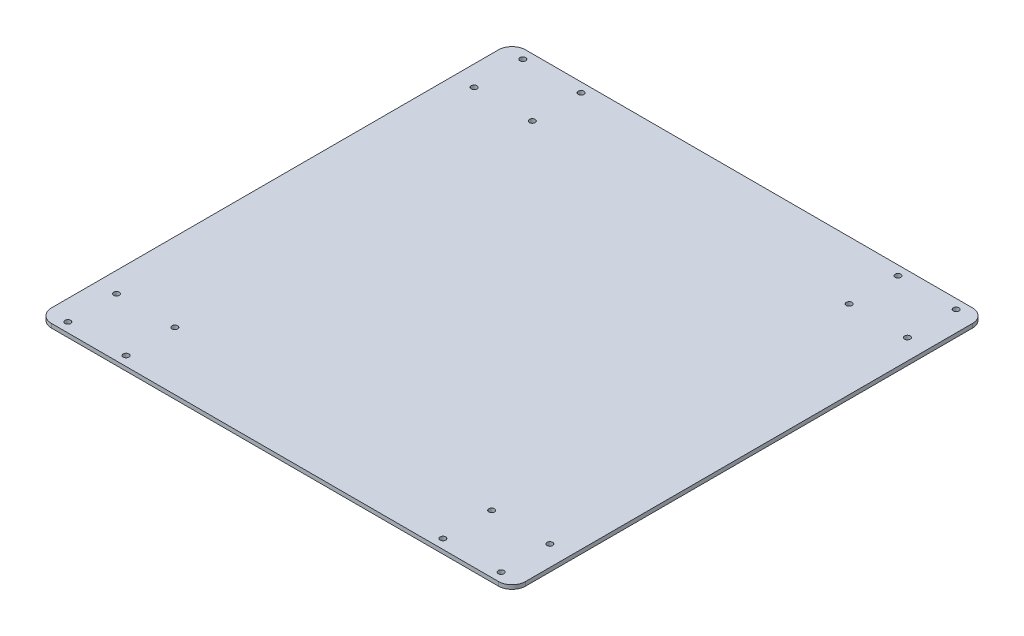
from build123d import *

# Parameters (mm, degrees)
SKETCH1_W           = 350
SKETCH1_H           = 350
BOSS_EXTRUDE1_DEPTH = 3
FILLET1_R           = 10
SKETCH2_R           = 2.1
CUT_EXTRUDE1_DEPTH  = 495.98383812


with BuildPart() as part:
    # Sketch1 → Boss-Extrude1 (new body)
    with BuildSketch(Plane(origin=(0, 0, 0), x_dir=(1, 0, 0), z_dir=(0, 1, 0))):
        with Locations((175, 175)):
            Rectangle(SKETCH1_W, SKETCH1_H)
    extrude(amount=BOSS_EXTRUDE1_DEPTH)

    # Fillet1
    fillet1_edges = [part.edges().sort_by_distance(p)[0] for p in [
        (0, 1.5, -350),
        (350, 1.5, -350),
        (350, 1.5, 0),
        (0, 1.5, 0),
    ]]
    fillet(fillet1_edges, radius=FILLET1_R)

    # Sketch2 → Cut-Extrude1 (cut, through all)
    with BuildSketch(Plane(origin=(0, 3, 0), x_dir=(1, 0, 0), z_dir=(0, 1, 0))):
        with Locations((15, 343)):
            Circle(SKETCH2_R)
        with Locations((58, 343)):
            Circle(SKETCH2_R)
        with Locations((15, 307)):
            Circle(SKETCH2_R)
        with Locations((58, 307)):
            Circle(SKETCH2_R)
        with Locations((292, 307)):
            Circle(SKETCH2_R)
        with Locations((335, 307)):
            Circle(SKETCH2_R)
        with Locations((292, 343)):
            Circle(SKETCH2_R)
        with Locations((335, 343)):
            Circle(SKETCH2_R)
        with Locations((335, 7)):
            Circle(SKETCH2_R)
        with Locations((292, 7)):
            Circle(SKETCH2_R)
        with Locations((335, 43)):
            Circle(SKETCH2_R)
        with Locations((292, 43)):
            Circle(SKETCH2_R)
        with Locations((58, 43)):
            Circle(SKETCH2_R)
        with Locations((15, 43)):
            Circle(SKETCH2_R)
        with Locations((58, 7)):
            Circle(SKETCH2_R)
        with Locations((15, 7)):
            Circle(SKETCH2_R)
    extrude(amount=-CUT_EXTRUDE1_DEPTH, mode=Mode.SUBTRACT)


solid = part.part
